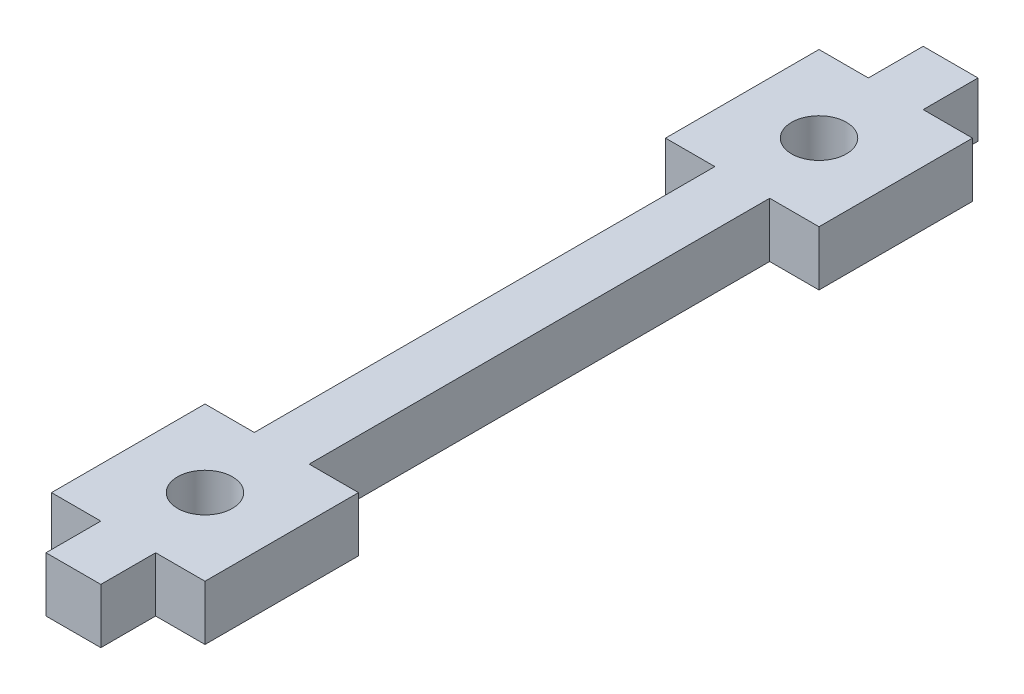
from build123d import *

# Parameters (mm, degrees)
SKETCH1_R           = 3.175
BOSS_EXTRUDE1_DEPTH = 6.35


with BuildPart() as part:
    # Sketch1 → Boss-Extrude1 (new body)
    with BuildSketch(Plane(origin=(0, 0, 0), x_dir=(1, 0, 0), z_dir=(0, 1, 0))):
        Polygon((0, 0), (0, 17.78), (-5.715, 17.78), (-5.715, 24.13), (-12.065, 24.13), (-12.065, 17.78), (-17.78, 17.78), (-17.78, 0), (-12.065, 0), (-12.065, -53.34), (-17.78, -53.34), (-17.78, -71.12), (-12.065, -71.12), (-12.065, -77.47), (-5.715, -77.47), (-5.715, -71.12), (0, -71.12), (0, -53.34), (-5.715, -53.34), (-5.715, 0), align=None)
        with Locations((-8.89, 8.89)):
            Circle(SKETCH1_R, mode=Mode.SUBTRACT)
        with Locations((-8.89, -62.23)):
            Circle(SKETCH1_R, mode=Mode.SUBTRACT)
    extrude(amount=BOSS_EXTRUDE1_DEPTH)


solid = part.part
